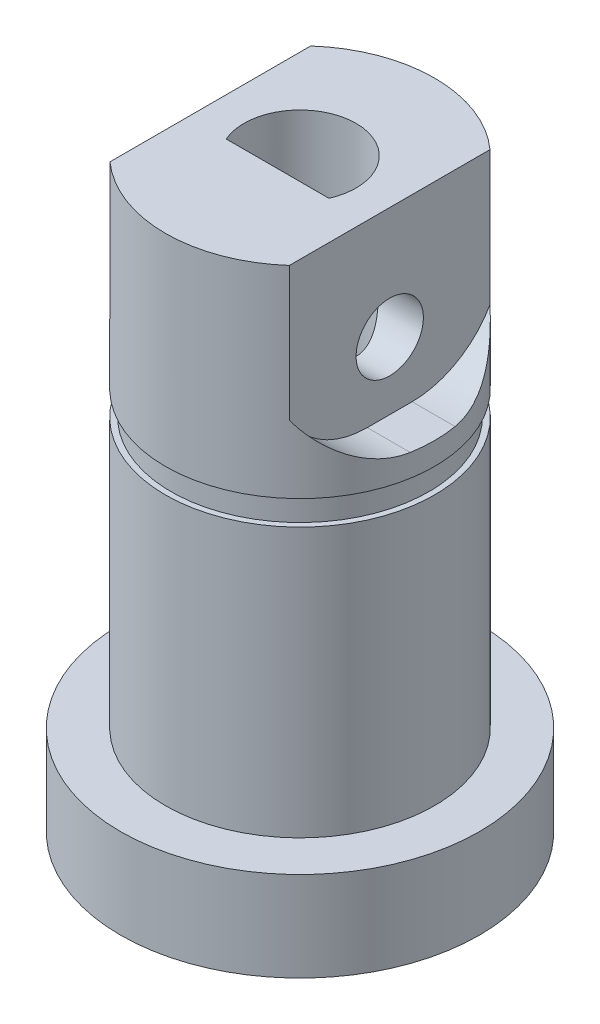
from build123d import *

# Parameters (mm, degrees)
CUT_EXTRUDE2_DEPTH = 2
SKETCH4_R          = 1.5
CUT_EXTRUDE3_DEPTH = 30.819624498
CUT_EXTRUDE4_DEPTH = 27.804663864


with BuildPart() as part:
    # Sketch2 → Revolve1 (revolve)
    with BuildSketch(Plane.XY):
        Polygon((0, 26.1), (-6, 26.1), (-6, 17.1), (-5.75, 17.1), (-5.75, 16), (-6, 16), (-6, 4), (-8, 4), (-8, 0), (-7, 0), (-7, 1.8), (0, 1.8), align=None)
    revolve(axis=Axis((0, 0, 0), (0, 1, 0)))

    # Sketch3 → Cut-Extrude2 (cut)
    with BuildSketch(Plane.ZY.offset(6)):
        with BuildLine():
            Line((9, 26.1), (-9, 26.1))
            ThreePointArc((-9, 26.1), (-6.171572875, 24.928427125), (-5, 22.1))
            ThreePointArc((-5, 22.1), (-3.828427125, 19.271572875), (-1, 18.1))
            Line((-1, 18.1), (1, 18.1))
            ThreePointArc((1, 18.1), (3.828427125, 19.271572875), (5, 22.1))
            ThreePointArc((5, 22.1), (6.171572875, 24.928427125), (9, 26.1))
        make_face()
    cut_extrude2 = extrude(amount=-CUT_EXTRUDE2_DEPTH, mode=Mode.SUBTRACT)

    # Mirror1: Cut-Extrude2 across plane
    add(cut_extrude2.mirror(Plane(origin=(0, 0, 0), x_dir=(0, 0, 1), z_dir=(1, 0, 0))), mode=Mode.SUBTRACT)

    # Sketch4 → Cut-Extrude3 (cut, through all)
    with BuildSketch(Plane.ZY.offset(4)):
        with Locations((0, 21.1)):
            Circle(SKETCH4_R)
    extrude(amount=-CUT_EXTRUDE3_DEPTH, mode=Mode.SUBTRACT)

    # Sketch5 → Cut-Extrude4 (cut, through all)
    with BuildSketch(Plane.XZ.offset(-1.8)):
        with BuildLine():
            Line((2.291287847, 1), (-2.291287847, 1))
            ThreePointArc((-2.291287847, 1), (-0.510774109, -2.447265782), (2.5, 0))
            ThreePointArc((2.5, 0), (2.447265782, 0.510774109), (2.291287847, 1))
        make_face()
    extrude(amount=-CUT_EXTRUDE4_DEPTH, mode=Mode.SUBTRACT)


solid = part.part
